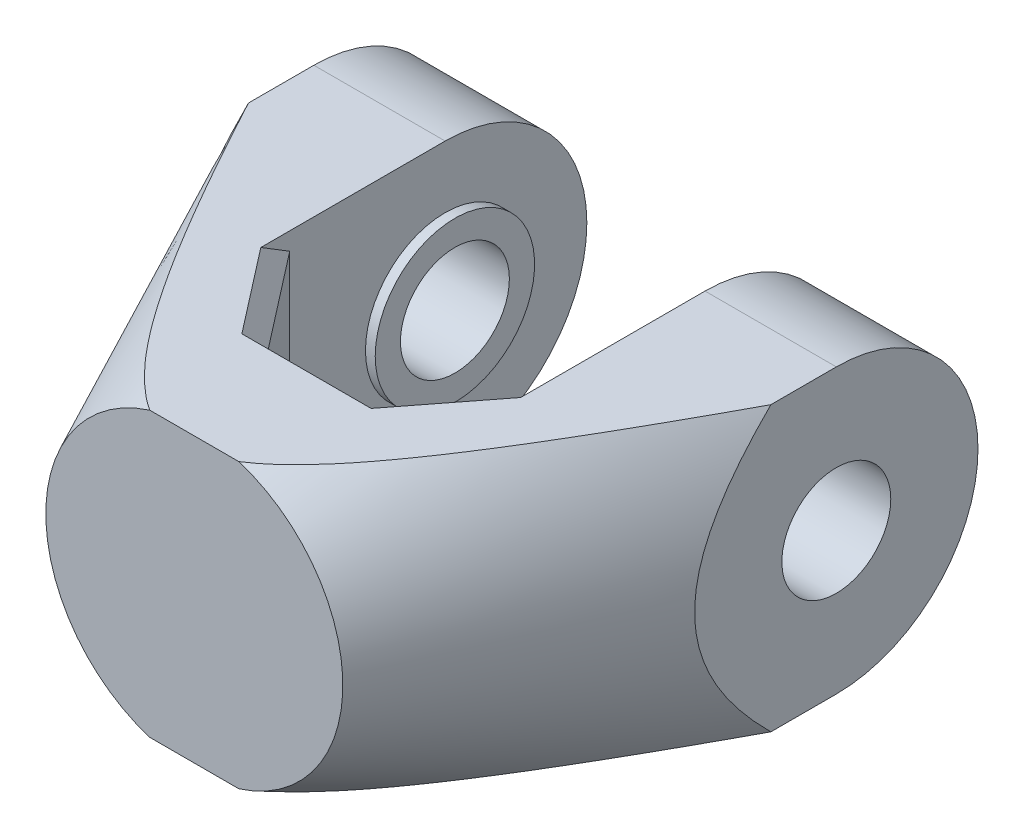
from build123d import *
from OCP.BRepFilletAPI import BRepFilletAPI_MakeChamfer

# Parameters (mm, degrees)
BOSS_EXTRUDE1_DEPTH             = 8
BOSS_EXTRUDE1_DEPTH_BACK        = 8
CUT_EXTRUDE1_DEPTH              = 31.525604007
CUT_EXTRUDE1_DEPTH_BACK         = 31.525604007
SKETCH2_R                       = 3.075
SKETCH4_W                       = 0.549849448
SKETCH4_H                       = 1.425
BOSS_EXTRUDE2_REACH             = 32.526
BOSS_EXTRUDE2_DIRECTION_2_REACH = 32.526
CUT_EXTRUDE3_DEPTH              = 38.467485904
CUT_EXTRUDE3_DEPTH_BACK         = 4
SKETCH12_R                      = 2
CHAMFER1_SIZE                   = 0.5
CHAMFER1_SIZE2                  = 1.045792293
CHAMFER2_SIZE                   = 1
CHAMFER2_SIZE_2                 = 0.735593413


with BuildPart() as part:
    # Sketch1 → Boss-Extrude1 (new, two sides: drawn at the far end of the back side and taken through both)
    with BuildSketch(Plane(origin=(0, 0, 0), x_dir=(1, 0, 0), z_dir=(0, 1, 0)).offset(-BOSS_EXTRUDE1_DEPTH_BACK)):
        Polygon((-7.336249448, 8), (-14.75, 8), (-14.75, -8), (-6.5, -25.5), (6.5, -25.5), (14.75, -8), (14.75, 8), (7.336249448, 8), (7.336249448, -8.776914416), (1.35, -16.5), (-1.35, -16.5), (-7.336249448, -8.776914416), align=None)
    extrude(amount=BOSS_EXTRUDE1_DEPTH + BOSS_EXTRUDE1_DEPTH_BACK)

    # Sketch2 → Cut-Extrude1 (cut, two sides: drawn at the far end of the back side and taken through both)
    with BuildSketch(Plane(origin=(0, 0, 0), x_dir=(0, 0, -1), z_dir=(1, 0, 0)).offset(-CUT_EXTRUDE1_DEPTH_BACK)):
        with BuildLine():
            ThreePointArc((8, -9e-09), (5.656854246, -5.656854253), (0, -8))
            Line((0, -8), (8, -8))
            Line((8, -8), (8, -9e-09))
        make_face()
        with BuildLine():
            ThreePointArc((0, 8), (5.656854253, 5.656854246), (8, -9e-09))
            Line((8, -9e-09), (8, 8))
            Line((8, 8), (0, 8))
        make_face()
        Circle(SKETCH2_R)
    extrude(amount=CUT_EXTRUDE1_DEPTH + CUT_EXTRUDE1_DEPTH_BACK, mode=Mode.SUBTRACT)

    # Sketch4 → Revolve2 (revolve)
    with BuildSketch(Plane(origin=(0, 0, 0), x_dir=(1, 0, 0), z_dir=(0, 1, 0)), mode=Mode.PRIVATE) as revolve2_sk:
        with Locations((7.061324724, -3.7875)):
            Rectangle(SKETCH4_W, SKETCH4_H)
    revolve2 = revolve(revolve2_sk.sketch.rotate(Axis((0, 0, 0), (1, 0, 0)), 180), axis=Axis((0, 0, 0), (1, 0, 0)))

    # Mirror1: Revolve2 across plane
    add(revolve2.mirror(Plane(origin=(0, 0, 0), x_dir=(0, 0, 1), z_dir=(1, 0, 0))))

    # Sketch8 → Cut-Revolve2 (revolve, cut)
    with BuildSketch(Plane(origin=(0, 0, 0), x_dir=(1, 0, 0), z_dir=(0, 1, 0)), mode=Mode.PRIVATE) as cut_revolve2_sk:
        Polygon((6.5, -25.5), (14.75, -8), (39.633624851, 44.783446654), (108.512816048, 26.763980306), (108.512816048, -25.5), align=None)
    revolve(cut_revolve2_sk.sketch.rotate(Axis((0, 0, 16.5), (0, 0, -1)), 208.474191333), axis=Axis((0, 0, 16.5), (0, 0, -1)), mode=Mode.SUBTRACT)

    # Boss-Extrude2: up to this plane
    boss_extrude2_end = Plane(origin=(1.35, -8, 16.5), z_dir=(-0.7903725294702838, 0, -0.6126265295094112))
    # Sketch9 → Boss-Extrude2 (add, up to the surface)
    with BuildSketch(Plane(origin=(0, 0, 0), x_dir=(0, 0, -1), z_dir=(1, 0, 0)), mode=Mode.PRIVATE) as boss_extrude2_sk1:
        with BuildLine():
            Line((-16.5, -9e-08), (-16.5, -8))
            Line((-16.5, -8), (-14.43086969, -8))
            ThreePointArc((-14.43086969, -8), (-15.974344261, -4.131625034), (-16.5, -9e-08))
        make_face()
    boss_extrude2_tool1 = split(extrude(boss_extrude2_sk1.sketch, amount=BOSS_EXTRUDE2_REACH, mode=Mode.PRIVATE), bisect_by=boss_extrude2_end, keep=Keep.BOTH, mode=Mode.PRIVATE)
    add(boss_extrude2_tool1.solids().sort_by_distance((0, -6.025945, 15.886555))[0])
    # Sketch9 → Boss-Extrude2 (add, up to the surface)
    with BuildSketch(Plane(origin=(0, 0, 0), x_dir=(0, 0, -1), z_dir=(1, 0, 0)), mode=Mode.PRIVATE) as boss_extrude2_sk2:
        with BuildLine():
            Line((-16.5, 8), (-16.5, -9e-08))
            ThreePointArc((-16.5, -9e-08), (-15.974344284, 4.131624947), (-14.43086969, 8))
            Line((-14.43086969, 8), (-16.5, 8))
        make_face()
    boss_extrude2_tool2 = split(extrude(boss_extrude2_sk2.sketch, amount=BOSS_EXTRUDE2_REACH, mode=Mode.PRIVATE), bisect_by=boss_extrude2_end, keep=Keep.BOTH, mode=Mode.PRIVATE)
    add(boss_extrude2_tool2.solids().sort_by_distance((0, 6.025945, 15.886555))[0])

    # Boss-Extrude2 direction 2: up to this plane
    boss_extrude2_direction_2_end = Plane(origin=(-1.35, -8, 16.5), z_dir=(0.7903725294702839, 0, -0.612626529509411))
    # Sketch9 → Boss-Extrude2 direction 2 (add, up to the surface)
    with BuildSketch(Plane(origin=(0, 0, 0), x_dir=(0, 0, -1), z_dir=(1, 0, 0)), mode=Mode.PRIVATE) as boss_extrude2_direction_2_sk1:
        with BuildLine():
            Line((-16.5, -9e-08), (-16.5, -8))
            Line((-16.5, -8), (-14.43086969, -8))
            ThreePointArc((-14.43086969, -8), (-15.974344261, -4.131625034), (-16.5, -9e-08))
        make_face()
    boss_extrude2_direction_2_tool1 = split(extrude(boss_extrude2_direction_2_sk1.sketch, amount=-BOSS_EXTRUDE2_DIRECTION_2_REACH, mode=Mode.PRIVATE), bisect_by=boss_extrude2_direction_2_end, keep=Keep.BOTH, mode=Mode.PRIVATE)
    add(boss_extrude2_direction_2_tool1.solids().sort_by_distance((0, -6.025945, 15.886555))[0])
    # Sketch9 → Boss-Extrude2 direction 2 (add, up to the surface)
    with BuildSketch(Plane(origin=(0, 0, 0), x_dir=(0, 0, -1), z_dir=(1, 0, 0)), mode=Mode.PRIVATE) as boss_extrude2_direction_2_sk2:
        with BuildLine():
            Line((-16.5, 8), (-16.5, -9e-08))
            ThreePointArc((-16.5, -9e-08), (-15.974344284, 4.131624947), (-14.43086969, 8))
            Line((-14.43086969, 8), (-16.5, 8))
        make_face()
    boss_extrude2_direction_2_tool2 = split(extrude(boss_extrude2_direction_2_sk2.sketch, amount=-BOSS_EXTRUDE2_DIRECTION_2_REACH, mode=Mode.PRIVATE), bisect_by=boss_extrude2_direction_2_end, keep=Keep.BOTH, mode=Mode.PRIVATE)
    add(boss_extrude2_direction_2_tool2.solids().sort_by_distance((0, 6.025945, 15.886555))[0])

    # Sketch12 → Cut-Extrude3 (cut, two sides: drawn at the far end of the back side and taken through both)
    with BuildSketch(Plane.XY.offset(25.5).offset(-CUT_EXTRUDE3_DEPTH_BACK)):
        with Locations(Location((0, 0, 0), (0, 0, 180))):
            Circle(SKETCH12_R)
    extrude(amount=CUT_EXTRUDE3_DEPTH + CUT_EXTRUDE3_DEPTH_BACK, mode=Mode.SUBTRACT)

    # Chamfer1: one chamfer whose edges measure the first distance from different faces: ONE call of the kernel's chamfer builder (chamfer() names one face for all edges)
    chamfer1_edges_1 = [part.edges().sort_by_distance(p)[0] for p in [
        (5.713707726, -3.098958538, 25.5),
    ]]
    chamfer1_side_1 = [part.faces().sort_by_distance(p)[0] for p in [
        (10.231854722, -5.54947769, 14.597156153),
    ]]
    chamfer1_edges_2 = [part.edges().sort_by_distance(p)[0] for p in [
        (2, 0, 25.5),
    ]]
    chamfer1 = BRepFilletAPI_MakeChamfer(part.part.solid().wrapped)
    for e in chamfer1_edges_1:
        chamfer1.Add(CHAMFER1_SIZE, CHAMFER1_SIZE2, e.wrapped, chamfer1_side_1[0].wrapped)  # the first distance lies on this face
    for e in chamfer1_edges_2:
        chamfer1.Add(CHAMFER1_SIZE, e.wrapped)
    add(Compound.cast(chamfer1.Shape()), mode=Mode.REPLACE)

    # Chamfer2
    # the kernel refuses this chamfer: 1, 0.735593413 mm, written as the material it takes off along each edge
    with BuildSketch(Plane(origin=(8.911730672, 8, 6.744326828), x_dir=(0.7903725294702837, 0, 0.6126265295094113), z_dir=(-0.6126265295094113, 0, 0.7903725294702838))) as chamfer2_piece_1_section:
        Polygon((CHAMFER2_SIZE, 0), (0, -CHAMFER2_SIZE), (0, 0), align=None)
    chamfer2_piece_1 = extrude(amount=12.296898092, mode=Mode.PRIVATE)
    chamfer2_piece_1 = split(chamfer2_piece_1, bisect_by=Plane(origin=(7.336249448, 8, 6.744326828), z_dir=(-1, 0, 0)), keep=Keep.TOP, mode=Mode.PRIVATE)
    chamfer2_piece_1 = chamfer2_piece_1 & Plane(origin=(8.911730672, 0, 0), x_dir=(0, -5.438658574002453e-09, 1.0), z_dir=(-1, 0, 0)) * Cylinder(16.5, 29, mode=Mode.PRIVATE)
    add(chamfer2_piece_1, mode=Mode.SUBTRACT)
    with BuildSketch(Plane(origin=(8.911730672, -8, 6.744326828), x_dir=(0.7903725294702837, 0, 0.6126265295094113), z_dir=(-0.6126265295094113, 0, 0.7903725294702838))) as chamfer2_piece_2_section:
        Polygon((CHAMFER2_SIZE, 0), (0, CHAMFER2_SIZE), (0, 0), align=None)
    chamfer2_piece_2 = extrude(amount=12.296898092, mode=Mode.PRIVATE)
    chamfer2_piece_2 = split(chamfer2_piece_2, bisect_by=Plane(origin=(7.336249448, -8, 6.744326828), z_dir=(-1, 0, 0)), keep=Keep.TOP, mode=Mode.PRIVATE)
    chamfer2_piece_2 = chamfer2_piece_2 & Plane(origin=(8.911730672, 0, 0), x_dir=(0, -0.48484848484848475, 0.8745981630098069), z_dir=(-1, 0, 0)) * Cylinder(16.5, 29, mode=Mode.PRIVATE)
    add(chamfer2_piece_2, mode=Mode.SUBTRACT)
    with BuildSketch(Plane(origin=(-1.37832467, 8, 16.463457278), x_dir=(-0.7903725294702839, 0, 0.6126265295094111), z_dir=(-0.6126265295094111, 0, -0.7903725294702839))) as chamfer2_piece_3_section:
        Polygon((CHAMFER2_SIZE, 0), (0, -CHAMFER2_SIZE), (0, 0), align=None)
    chamfer2_piece_3 = extrude(amount=12.296898092, mode=Mode.PRIVATE)
    chamfer2_piece_3 = split(chamfer2_piece_3, bisect_by=Plane(origin=(-7.336249448, 8, 16.463457278), z_dir=(1, 0, 0)), keep=Keep.TOP, mode=Mode.PRIVATE)
    chamfer2_piece_3 = chamfer2_piece_3 & Plane(origin=(-1.37832467, 0, 0), x_dir=(0, -5.438658574002453e-09, 1.0), z_dir=(1, 0, 0)) * Cylinder(16.5, 29, mode=Mode.PRIVATE)
    add(chamfer2_piece_3, mode=Mode.SUBTRACT)
    with BuildSketch(Plane(origin=(-1.37832467, -8, 16.463457278), x_dir=(-0.7903725294702838, 0, 0.6126265295094111), z_dir=(-0.6126265295094111, 0, -0.7903725294702839))) as chamfer2_piece_4_section:
        Polygon((CHAMFER2_SIZE, 0), (0, CHAMFER2_SIZE), (0, 0), align=None)
    chamfer2_piece_4 = extrude(amount=12.296898092, mode=Mode.PRIVATE)
    chamfer2_piece_4 = chamfer2_piece_4 & Plane(origin=(-1.37832467, 0, 0), x_dir=(0, -0.48484848484848475, 0.8745981630098069), z_dir=(1, 0, 0)) * Cylinder(16.5, 29, mode=Mode.PRIVATE)
    chamfer2_piece_4 = split(chamfer2_piece_4, bisect_by=Plane(origin=(-7.336249448, -8, 16.463457278), z_dir=(1, 0, 0)), keep=Keep.TOP, mode=Mode.PRIVATE)
    add(chamfer2_piece_4, mode=Mode.SUBTRACT)
    with BuildSketch(Plane(origin=(0, 8, 14.43086969), x_dir=(0, 0, 1), z_dir=(-1, 0, 0))) as chamfer2_piece_5_section:
        with BuildLine():
            Line((CHAMFER2_SIZE_2, 0), (0.47224964, -0.918542928))
            ThreePointArc((0.47224964, -0.918542928), (0.2499823, -0.46856024), (0, 0))
            Line((0, 0), (CHAMFER2_SIZE_2, 0))
        make_face()
    chamfer2_piece_5 = extrude(amount=5.609656259, mode=Mode.PRIVATE)
    chamfer2_piece_5 = split(chamfer2_piece_5, bisect_by=Plane(origin=(-1.845209268, 8, 15.861111896), z_dir=(0.7903725294702839, 0, -0.6126265295094111)), keep=Keep.TOP, mode=Mode.PRIVATE)
    add(chamfer2_piece_5, mode=Mode.SUBTRACT)
    with BuildSketch(Plane(origin=(0, -8, 14.43086969), x_dir=(0, 0, 1), z_dir=(-1, 0, 0))) as chamfer2_piece_6_section:
        with BuildLine():
            Line((CHAMFER2_SIZE, 0), (0.344426995, 0.655573005))
            ThreePointArc((0.344426995, 0.655573005), (0.17865839, 0.331122032), (0, 0))
            Line((0, 0), (CHAMFER2_SIZE, 0))
        make_face()
    chamfer2_piece_6 = extrude(amount=5.525488882, mode=Mode.PRIVATE)
    chamfer2_piece_6 = split(chamfer2_piece_6, bisect_by=Plane(origin=(-1.845209268, -8, 15.861111896), z_dir=(0.7903725294702839, 0, -0.6126265295094111)), keep=Keep.TOP, mode=Mode.PRIVATE)
    add(chamfer2_piece_6, mode=Mode.SUBTRACT)
    with BuildSketch(Plane(origin=(0, -8, 14.43086969), x_dir=(0, 0, 1), z_dir=(1, 0, 0))) as chamfer2_piece_7_section:
        with BuildLine():
            Line((CHAMFER2_SIZE, 0), (0.344426995, -0.655573005))
            ThreePointArc((0.344426995, -0.655573005), (0.17865839, -0.331122032), (0, 0))
            Line((0, 0), (CHAMFER2_SIZE, 0))
        make_face()
    chamfer2_piece_7 = extrude(amount=5.525488882, mode=Mode.PRIVATE)
    chamfer2_piece_7 = split(chamfer2_piece_7, bisect_by=Plane(origin=(1.845209268, -8, 15.861111896), z_dir=(-0.7903725294702837, 0, -0.6126265295094113)), keep=Keep.TOP, mode=Mode.PRIVATE)
    add(chamfer2_piece_7, mode=Mode.SUBTRACT)
    with BuildSketch(Plane(origin=(0, 8, 14.43086969), x_dir=(0, 0, 1), z_dir=(1, 0, 0))) as chamfer2_piece_8_section:
        with BuildLine():
            Line((CHAMFER2_SIZE_2, 0), (0.47224964, 0.918542928))
            ThreePointArc((0.47224964, 0.918542928), (0.2499823, 0.46856024), (0, 0))
            Line((0, 0), (CHAMFER2_SIZE_2, 0))
        make_face()
    chamfer2_piece_8 = extrude(amount=5.609656259, mode=Mode.PRIVATE)
    chamfer2_piece_8 = split(chamfer2_piece_8, bisect_by=Plane(origin=(1.845209268, 8, 15.861111896), z_dir=(-0.7903725294702837, 0, -0.6126265295094113)), keep=Keep.TOP, mode=Mode.PRIVATE)
    add(chamfer2_piece_8, mode=Mode.SUBTRACT)
    with BuildSketch(Plane(origin=(8.911730672, 8, 6.744326828), x_dir=(0.7903725294702837, 0, 0.6126265295094113), z_dir=(-0.6126265295094113, 0, 0.7903725294702838))) as chamfer2_piece_9a_section:
        Polygon((CHAMFER2_SIZE, 0), (0, -CHAMFER2_SIZE), (0, 0), align=None)
    chamfer2_piece_9a = extrude(amount=12.296898092, mode=Mode.PRIVATE)
    chamfer2_piece_9a = chamfer2_piece_9a - Plane(origin=(8.911730672, 0, 0), x_dir=(0, -5.438658574002453e-09, 1.0), z_dir=(-1, 0, 0)) * Cylinder(16.5, 29, mode=Mode.PRIVATE)
    with BuildSketch(Plane(origin=(0, 8, 14.43086969), x_dir=(0, 0, 1), z_dir=(1, 0, 0))) as chamfer2_piece_9b_section:
        with BuildLine():
            Line((CHAMFER2_SIZE_2, 0), (0.47224964, 0.918542928))
            ThreePointArc((0.47224964, 0.918542928), (0.2499823, 0.46856024), (0, 0))
            Line((0, 0), (CHAMFER2_SIZE_2, 0))
        make_face()
    chamfer2_piece_9b = extrude(amount=5.609656259, mode=Mode.PRIVATE)
    chamfer2_piece_9b = split(chamfer2_piece_9b, bisect_by=Plane(origin=(1.845209268, 8, 15.861111896), z_dir=(0.7903725294702837, 0, 0.6126265295094113)), keep=Keep.TOP, mode=Mode.PRIVATE)
    chamfer2_piece_9 = chamfer2_piece_9a & chamfer2_piece_9b
    add(chamfer2_piece_9, mode=Mode.SUBTRACT)
    with BuildSketch(Plane(origin=(8.911730672, -8, 6.744326828), x_dir=(0.7903725294702837, 0, 0.6126265295094113), z_dir=(-0.6126265295094113, 0, 0.7903725294702838))) as chamfer2_piece_10a_section:
        Polygon((CHAMFER2_SIZE, 0), (0, CHAMFER2_SIZE), (0, 0), align=None)
    chamfer2_piece_10a = extrude(amount=12.296898092, mode=Mode.PRIVATE)
    chamfer2_piece_10a = chamfer2_piece_10a - Plane(origin=(8.911730672, 0, 0), x_dir=(0, -0.48484848484848475, 0.8745981630098069), z_dir=(-1, 0, 0)) * Cylinder(16.5, 29, mode=Mode.PRIVATE)
    with BuildSketch(Plane(origin=(0, -8, 14.43086969), x_dir=(0, 0, 1), z_dir=(1, 0, 0))) as chamfer2_piece_10b_section:
        with BuildLine():
            Line((CHAMFER2_SIZE, 0), (0.344426995, -0.655573005))
            ThreePointArc((0.344426995, -0.655573005), (0.17865839, -0.331122032), (0, 0))
            Line((0, 0), (CHAMFER2_SIZE, 0))
        make_face()
    chamfer2_piece_10b = extrude(amount=5.525488882, mode=Mode.PRIVATE)
    chamfer2_piece_10b = split(chamfer2_piece_10b, bisect_by=Plane(origin=(1.845209268, -8, 15.861111896), z_dir=(0.7903725294702837, 0, 0.6126265295094113)), keep=Keep.TOP, mode=Mode.PRIVATE)
    chamfer2_piece_10 = chamfer2_piece_10a & chamfer2_piece_10b
    add(chamfer2_piece_10, mode=Mode.SUBTRACT)
    with BuildSketch(Plane(origin=(-1.37832467, 8, 16.463457278), x_dir=(-0.7903725294702839, 0, 0.6126265295094111), z_dir=(-0.6126265295094111, 0, -0.7903725294702839))) as chamfer2_piece_11a_section:
        Polygon((CHAMFER2_SIZE, 0), (0, -CHAMFER2_SIZE), (0, 0), align=None)
    chamfer2_piece_11a = extrude(amount=12.296898092, mode=Mode.PRIVATE)
    chamfer2_piece_11a = chamfer2_piece_11a - Plane(origin=(-1.37832467, 0, 0), x_dir=(0, -5.438658574002453e-09, 1.0), z_dir=(1, 0, 0)) * Cylinder(16.5, 29, mode=Mode.PRIVATE)
    with BuildSketch(Plane(origin=(0, 8, 14.43086969), x_dir=(0, 0, 1), z_dir=(-1, 0, 0))) as chamfer2_piece_11b_section:
        with BuildLine():
            Line((CHAMFER2_SIZE_2, 0), (0.47224964, -0.918542928))
            ThreePointArc((0.47224964, -0.918542928), (0.2499823, -0.46856024), (0, 0))
            Line((0, 0), (CHAMFER2_SIZE_2, 0))
        make_face()
    chamfer2_piece_11b = extrude(amount=5.609656259, mode=Mode.PRIVATE)
    chamfer2_piece_11b = split(chamfer2_piece_11b, bisect_by=Plane(origin=(-1.845209268, 8, 15.861111896), z_dir=(-0.7903725294702839, 0, 0.6126265295094111)), keep=Keep.TOP, mode=Mode.PRIVATE)
    chamfer2_piece_11 = chamfer2_piece_11a & chamfer2_piece_11b
    add(chamfer2_piece_11, mode=Mode.SUBTRACT)
    with BuildSketch(Plane(origin=(-1.37832467, -8, 16.463457278), x_dir=(-0.7903725294702838, 0, 0.6126265295094111), z_dir=(-0.6126265295094111, 0, -0.7903725294702839))) as chamfer2_piece_12a_section:
        Polygon((CHAMFER2_SIZE, 0), (0, CHAMFER2_SIZE), (0, 0), align=None)
    chamfer2_piece_12a = extrude(amount=12.296898092, mode=Mode.PRIVATE)
    chamfer2_piece_12a = chamfer2_piece_12a - Plane(origin=(-1.37832467, 0, 0), x_dir=(0, -0.48484848484848475, 0.8745981630098069), z_dir=(1, 0, 0)) * Cylinder(16.5, 29, mode=Mode.PRIVATE)
    with BuildSketch(Plane(origin=(0, -8, 14.43086969), x_dir=(0, 0, 1), z_dir=(-1, 0, 0))) as chamfer2_piece_12b_section:
        with BuildLine():
            Line((CHAMFER2_SIZE, 0), (0.344426995, 0.655573005))
            ThreePointArc((0.344426995, 0.655573005), (0.17865839, 0.331122032), (0, 0))
            Line((0, 0), (CHAMFER2_SIZE, 0))
        make_face()
    chamfer2_piece_12b = extrude(amount=5.525488882, mode=Mode.PRIVATE)
    chamfer2_piece_12b = split(chamfer2_piece_12b, bisect_by=Plane(origin=(-1.845209268, -8, 15.861111896), z_dir=(-0.7903725294702839, 0, 0.6126265295094111)), keep=Keep.TOP, mode=Mode.PRIVATE)
    chamfer2_piece_12 = chamfer2_piece_12a & chamfer2_piece_12b
    add(chamfer2_piece_12, mode=Mode.SUBTRACT)

    # SurfaceCut1
    split(bisect_by=Plane.XY.offset(21.5), keep=Keep.BOTTOM)


solid = part.part
